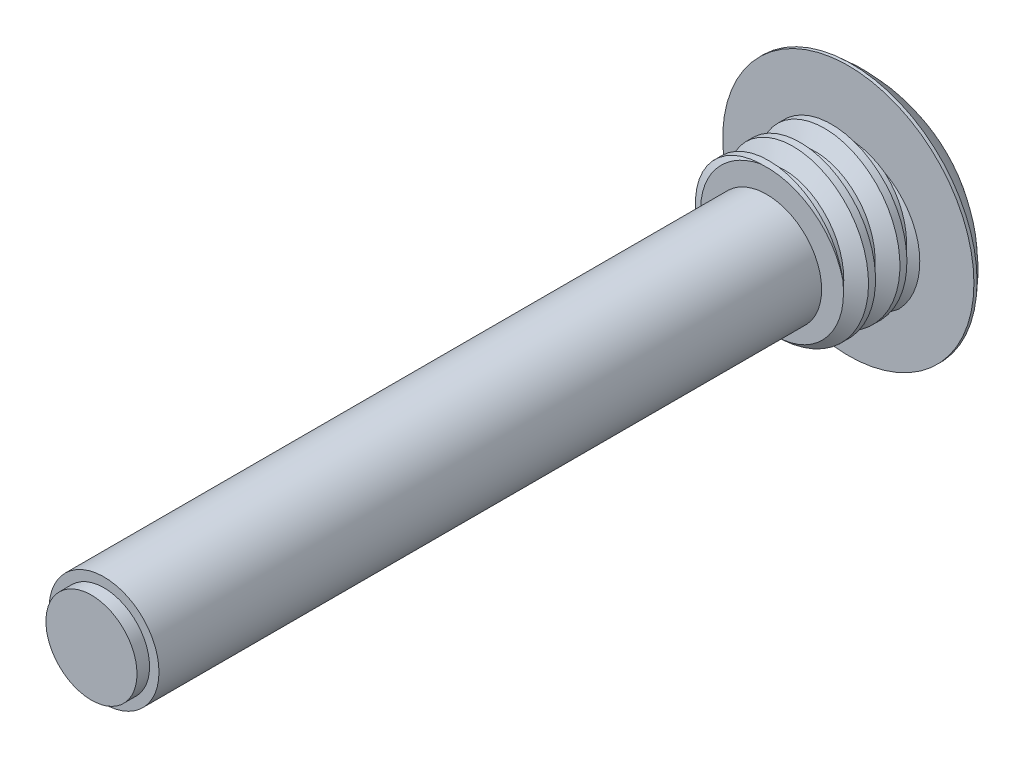
from build123d import *

# Parameters (mm, degrees)
SKETCH3_R           = 3.175
BOSS_EXTRUDE1_DEPTH = 3.302
CUT_SWEEP1_PITCH    = 1.27
SKETCH10_R          = 2.2225
BOSS_EXTRUDE5_DEPTH = 26.797
SKETCH9_R           = 5.08
BOSS_EXTRUDE4_DEPTH = 0.127
DOME3_FACE_RADIUS   = 5.08
DOME3_HEIGHT        = 2.38
SKETCH11_R          = 1.8415
BOSS_EXTRUDE6_DEPTH = 0.508


with BuildPart() as part:
    # Sketch3 → Boss-Extrude1 (new body)
    with BuildSketch(Plane.XY):
        with Locations(Location((0, 0, 0), (0, 0, 180))):
            Circle(SKETCH3_R)
    extrude(amount=BOSS_EXTRUDE1_DEPTH)

    # Cut-Sweep1: arcs per turn and ends read off the stored shape
    # Cut-Sweep1: the profile of Sketch5 profile screwed along a left-hand helix through 4.5 turns, 8 arcs to a turn; built about Z, then put on its axis
    cut_sweep1_z = Axis((0, 0, 0), (0, 0, 1))
    cut_sweep1_corners = [(2.54, 0, -1.397), (3.1753, 0, -1.763790626), (3.1753, 0, -0.776209374), (2.54, 0, -1.143)]
    with BuildLine(mode=Mode.PRIVATE) as cut_sweep1_profile:
        Line(cut_sweep1_corners[0], cut_sweep1_corners[1])
        Line(cut_sweep1_corners[1], cut_sweep1_corners[2])
        Line(cut_sweep1_corners[2], cut_sweep1_corners[3])
        Line(cut_sweep1_corners[3], cut_sweep1_corners[0])
    cut_sweep1_cap = Face(cut_sweep1_profile.wire())
    cut_sweep1_turn_angles = [0, -22.5, -45, -67.5, -90, -112.5, -135, -157.5, -180, -202.5, -225, -247.5, -270, -292.5, -315, -337.5, -360]
    cut_sweep1_turn_weights = [1, 0.9238795325112867, 1, 0.9238795325112867, 1, 0.9238795325112867, 1, 0.9238795325112867, 1, 0.9238795325112867, 1, 0.9238795325112867, 1, 0.9238795325112867, 1, 0.9238795325112867, 1]
    cut_sweep1_turn_rails = [Edge.make_bspline([Vector(p[0], p[1], 0).rotate(cut_sweep1_z, cut_sweep1_turn_angles[k]) / cut_sweep1_turn_weights[k] + Vector(0, 0, p[2] + -CUT_SWEEP1_PITCH * cut_sweep1_turn_angles[k] / 360) for k in range(17)], [0, 0, 0, 1, 1, 2, 2, 3, 3, 4, 4, 5, 5, 6, 6, 7, 7, 8, 8, 8], 2, cut_sweep1_turn_weights) for p in cut_sweep1_corners]
    cut_sweep1_turn_sides = [Face.make_surface_from_curves(cut_sweep1_turn_rails[p[0]], cut_sweep1_turn_rails[p[1]]) for p in [(0, 1), (1, 2), (2, 3), (3, 0)]]
    cut_sweep1_last_angles = [-1440, -1462.5, -1485, -1507.5, -1530, -1552.5, -1575, -1597.5, -1620]
    cut_sweep1_last_weights = [1, 0.9238795325112867, 1, 0.9238795325112867, 1, 0.9238795325112867, 1, 0.9238795325112867, 1]
    cut_sweep1_last_rails = [Edge.make_bspline([Vector(p[0], p[1], 0).rotate(cut_sweep1_z, cut_sweep1_last_angles[k]) / cut_sweep1_last_weights[k] + Vector(0, 0, p[2] + -CUT_SWEEP1_PITCH * cut_sweep1_last_angles[k] / 360) for k in range(9)], [0, 0, 0, 1, 1, 2, 2, 3, 3, 4, 4, 4], 2, cut_sweep1_last_weights) for p in cut_sweep1_corners]
    cut_sweep1_last_sides = [Face.make_surface_from_curves(cut_sweep1_last_rails[p[0]], cut_sweep1_last_rails[p[1]]) for p in [(0, 1), (1, 2), (2, 3), (3, 0)]]
    cut_sweep1 = Plane(origin=(0, 0, 0), x_dir=(0, 1, 0), z_dir=(0, 0, 1)) * Solid(Shell([*[p.moved(Location((0, 0, CUT_SWEEP1_PITCH * i))) for i in range(4) for p in cut_sweep1_turn_sides], *cut_sweep1_last_sides, cut_sweep1_cap, cut_sweep1_cap.rotate(cut_sweep1_z, -1620).moved(Location((0, 0, -CUT_SWEEP1_PITCH * -1620 / 360)))]))
    add(cut_sweep1, mode=Mode.SUBTRACT)

    # Sketch10 → Boss-Extrude5 (add)
    with BuildSketch(Plane.XY.offset(3.302)):
        Circle(SKETCH10_R)
    extrude(amount=BOSS_EXTRUDE5_DEPTH)

    # Sketch9 → Boss-Extrude4 (add)
    with BuildSketch(Plane.XY):
        Circle(SKETCH9_R)
    extrude(amount=-BOSS_EXTRUDE4_DEPTH)

    # Dome3: a dome of height H over a round flat face of radius A is a cap of a sphere of radius (A * A + H * H) / (2 * H)
    dome3_r = (DOME3_FACE_RADIUS * DOME3_FACE_RADIUS + DOME3_HEIGHT * DOME3_HEIGHT) / (2 * DOME3_HEIGHT)
    dome3_base = Plane((0, 0, -0.127), z_dir=(0, 0, -1))
    with Locations(dome3_base.offset(DOME3_HEIGHT - dome3_r)):
        dome3_ball = Sphere(dome3_r, mode=Mode.PRIVATE)
    add(split(dome3_ball, bisect_by=dome3_base, keep=Keep.TOP, mode=Mode.PRIVATE))

    # Sketch11 → Boss-Extrude6 (add)
    with BuildSketch(Plane.XY.offset(30.099)):
        Circle(SKETCH11_R)
    extrude(amount=BOSS_EXTRUDE6_DEPTH)


solid = part.part
